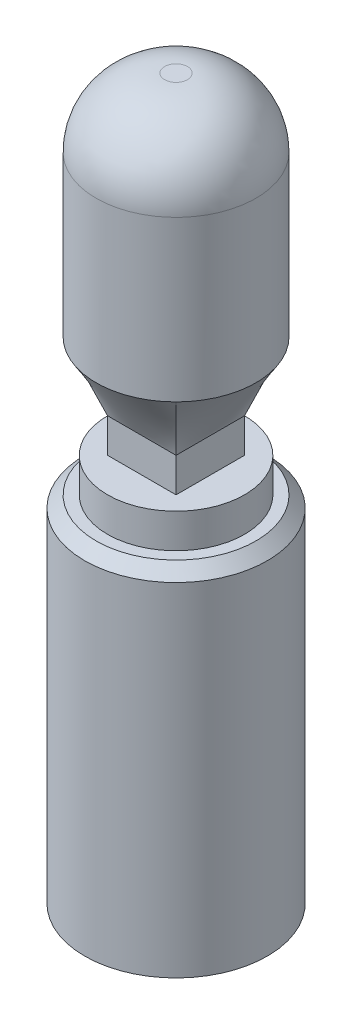
from build123d import *

# Parameters (mm, degrees)
SKETCH1_R           = 8
BOSS_EXTRUDE1_DEPTH = 30
SKETCH2_R           = 8
BOSS_EXTRUDE2_DEPTH = 1
BOSS_EXTRUDE2_TAPER = 45
SKETCH3_R           = 6
BOSS_EXTRUDE3_DEPTH = 3
SKETCH4_W           = 6
SKETCH4_H           = 6
BOSS_EXTRUDE4_DEPTH = 3
BOSS_EXTRUDE5_DEPTH = 20
SKETCH9_R           = 2.05
CUT_EXTRUDE1_DEPTH  = 6


with BuildPart() as part:
    # Sketch1 → Boss-Extrude1 (new body)
    with BuildSketch(Plane(origin=(0, 0, 0), x_dir=(1, 0, 0), z_dir=(0, 1, 0))):
        with Locations(Location((0, 0, 0), (0, 0, 270))):
            Circle(SKETCH1_R)
    extrude(amount=BOSS_EXTRUDE1_DEPTH)

    # Sketch2 → Boss-Extrude2 (add)
    with BuildSketch(Plane(origin=(0, 30, 0), x_dir=(1, 0, 0), z_dir=(0, 1, 0))):
        with Locations(Location((0, 0, 0), (0, 0, 270))):
            Circle(SKETCH2_R)
    extrude(amount=BOSS_EXTRUDE2_DEPTH, taper=BOSS_EXTRUDE2_TAPER)

    # Sketch3 → Boss-Extrude3 (add)
    with BuildSketch(Plane(origin=(0, 31, 0), x_dir=(1, 0, 0), z_dir=(0, 1, 0))):
        with Locations(Location((0, 0, 0), (0, 0, 270))):
            Circle(SKETCH3_R)
    extrude(amount=BOSS_EXTRUDE3_DEPTH)

    # Sketch4 → Boss-Extrude4 (add)
    with BuildSketch(Plane(origin=(0, 34, 0), x_dir=(1, 0, 0), z_dir=(0, 1, 0))):
        Rectangle(SKETCH4_W, SKETCH4_H)
    extrude(amount=BOSS_EXTRUDE4_DEPTH)

    # Sketch6 for Loft1 → Loft1 section 0
    with BuildSketch(Plane(origin=(0, 43, 0), x_dir=(1, 0, 0), z_dir=(0, 1, 0))):
        with BuildLine():
            # circular arc as an exact rational Bezier (weights 1, cos(half-angle), 1)
            Bezier((4.949747468, -4.949747468), (9.899494937, 0), (4.949747468, 4.949747468), weights=[1, 0.707106781, 1])
            Bezier((4.949747468, 4.949747468), (0, 9.899494937), (-4.949747468, 4.949747468), weights=[1, 0.707106781, 1])
            Bezier((-4.949747468, 4.949747468), (-9.899494937, 0), (-4.949747468, -4.949747468), weights=[1, 0.707106781, 1])
            Bezier((-4.949747468, -4.949747468), (0, -9.899494937), (4.949747468, -4.949747468), weights=[1, 0.707106781, 1])
        make_face()
    # Sketch5 → Loft1 section 1
    with BuildSketch(Plane(origin=(0, 37, 0), x_dir=(1, 0, 0), z_dir=(0, 1, 0))):
        with BuildLine():
            Line((3, -3), (3, 3))
            Line((3, 3), (-3, 3))
            Line((-3, 3), (-3, -3))
            Line((-3, -3), (3, -3))
        make_face()
    loft()

    # Sketch7 → Boss-Extrude5 (add)
    with BuildSketch(Plane(origin=(0, 43, 0), x_dir=(1, 0, 0), z_dir=(0, 1, 0))):
        with BuildLine():
            ThreePointArc((4.949747468, -4.949747468), (7, 0), (4.949747468, 4.949747468))
            ThreePointArc((4.949747468, 4.949747468), (0, 7), (-4.949747468, 4.949747468))
            ThreePointArc((-4.949747468, 4.949747468), (-7, 0), (-4.949747468, -4.949747468))
            ThreePointArc((-4.949747468, -4.949747468), (0, -7), (4.949747468, -4.949747468))
        make_face()
    extrude(amount=BOSS_EXTRUDE5_DEPTH)

    # Fillet1: read off the stored shape, not the designer's step
    # Fillet1 outline → Fillet1 (revolve, cut)
    with BuildSketch(Plane.XY):
        with BuildLine():
            ThreePointArc((1, 63), (5.242640687, 61.242640687), (7, 57))
            Line((7, 57), (7, 63))
            Line((7, 63), (1, 63))
        make_face()
    revolve(axis=Axis((0, 0, 0), (0, 1, 0)), mode=Mode.SUBTRACT)

    # Sketch9 → Cut-Extrude1 (cut)
    with BuildSketch(Plane.XZ):
        with Locations(Location((0, 0, 0), (0, 0, 270))):
            Circle(SKETCH9_R)
    extrude(amount=-CUT_EXTRUDE1_DEPTH, mode=Mode.SUBTRACT)


solid = part.part
